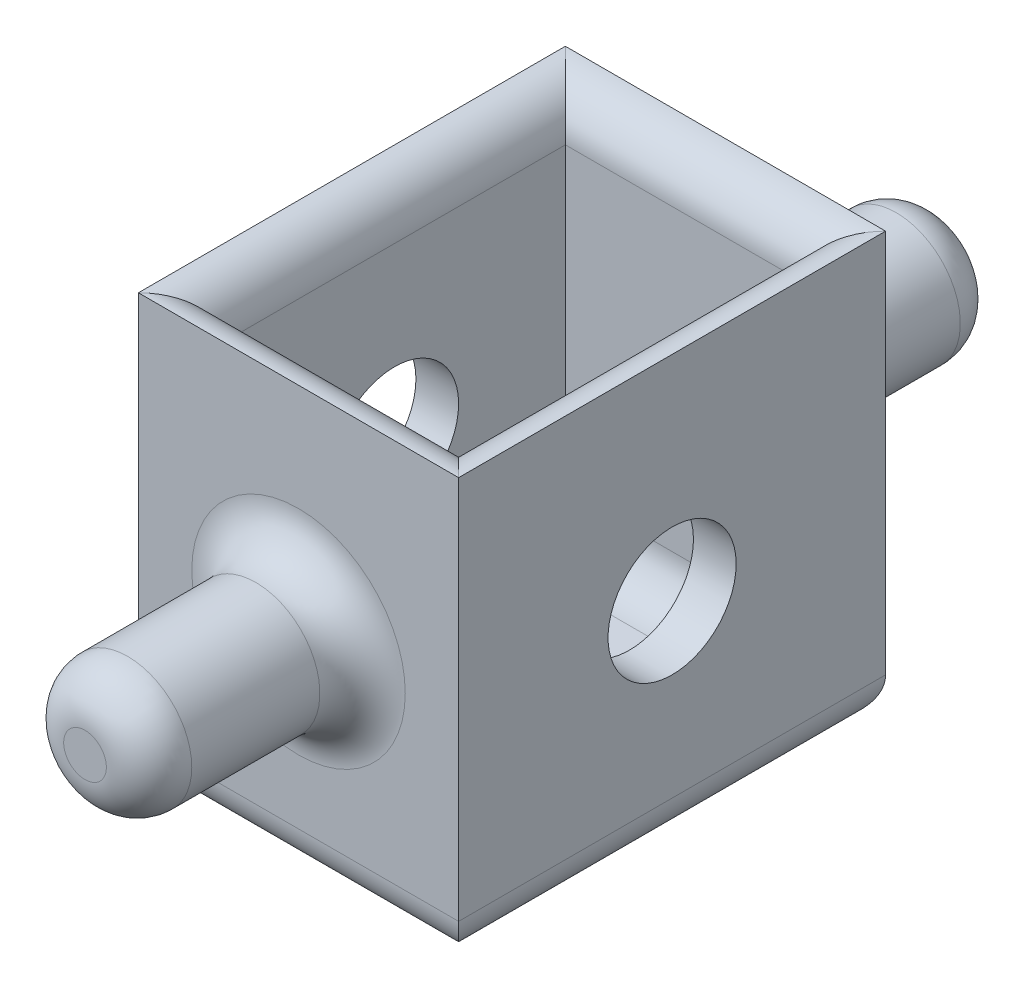
from build123d import *

# Parameters (mm, degrees)
SKETCH1_W          = 19.05
SKETCH1_H          = 25.4
MAIN_BODY_DEPTH    = 25.4
HOLLOW_IT_T        = -2.54
SKETCH3_R          = 3.81
NIBBLE_NO_1_DEPTH  = 12.7
NIBBLE_START       = 12.7
SKETCH4_R          = 3.81
NIBBLE_NO_2_DEPTH  = 12.7
SKETCH5_W          = 1.27
SKETCH5_H          = 3.81
FLAG_DEPTH         = 0.254
SKETCH2_R          = 3.81
NIBBLE_HOLES_DEPTH = 45.45
SMOOTHNESS_R       = 2.54


with BuildPart() as part:
    # Sketch1 → main body (new body)
    with BuildSketch(Plane.XY):
        Rectangle(SKETCH1_W, SKETCH1_H)
    extrude(amount=MAIN_BODY_DEPTH)

    # hollow it
    hollow_it_openings = [part.faces().sort_by_distance(p)[0] for p in [
        (0, 12.7, 12.7),
    ]]
    offset(amount=HOLLOW_IT_T, openings=hollow_it_openings, kind=Kind.INTERSECTION)

    # Sketch3 → nibble no 1 (add)
    with BuildSketch(Plane.XY.offset(25.4)):
        with Locations(Location((0, 0, 0), (0, 0, 180))):
            Circle(SKETCH3_R)
    extrude(amount=NIBBLE_NO_1_DEPTH)

    # Sketch4 → nibble no 2 (add)
    with BuildSketch(Plane(origin=(0, 0, 0), x_dir=(-1, 0, 0), z_dir=(0, 0, -1)).offset(NIBBLE_START)):
        Circle(SKETCH4_R)
    extrude(amount=-NIBBLE_NO_2_DEPTH)

    # Sketch5 → flag (add)
    with BuildSketch(Plane(origin=(0, 0, 0), x_dir=(-1, 0, 0), z_dir=(0, -1, 0))):
        with Locations((-0.18666561, 6.353298227)):
            Rectangle(SKETCH5_W, SKETCH5_H)
    extrude(amount=FLAG_DEPTH)

    # Sketch2 → nibble holes (cut, through all)
    with BuildSketch(Plane(origin=(9.525, 0, 0), x_dir=(0, 0, -1), z_dir=(1, 0, 0))):
        with Locations((-12.7, 0)):
            Circle(SKETCH2_R)
    extrude(amount=-NIBBLE_HOLES_DEPTH, mode=Mode.SUBTRACT)

    # smoothness
    smoothness_edges = [part.edges().sort_by_distance(p)[0] for p in [
        (0, -12.7, 25.4),
        (6.985, -10.16, 12.7),
        (0, 12.7, 2.54),
        (6.985, 12.7, 12.7),
        (-6.985, 12.7, 12.7),
        (0, -10.16, 2.54),
        (-6.985, -10.16, 12.7),
        (0, 12.7, 22.86),
        (0, -10.16, 22.86),
        (3.81, 0, 25.4),
        (3.81, 0, 38.1),
        (3.81, 0, 0),
        (3.81, 0, -12.7),
        (0, -12.7, 0),
        (9.525, -12.7, 12.7),
        (-9.525, -12.7, 12.7),
    ]]
    fillet(smoothness_edges, radius=SMOOTHNESS_R - 0.0001)  # a hair under: the kernel refuses the full size


solid = part.part
